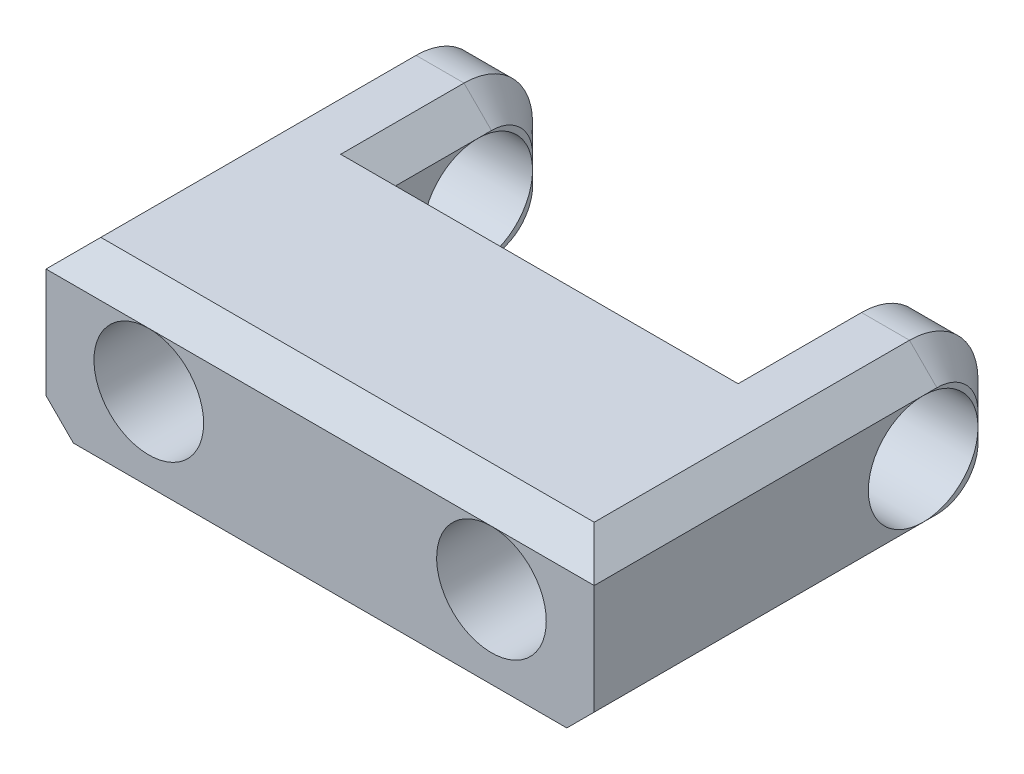
from build123d import *

# Parameters (mm, degrees)
SKETCH1_W           = 40
SKETCH1_H           = 30
BOSS_EXTRUDE1_DEPTH = 12
SKETCH2_W           = 25
SKETCH2_H           = 12
CUT_EXTRUDE1_DEPTH  = 12
SKETCH3_R           = 4
CUT_EXTRUDE2_DEPTH  = 100
FILLET1_R           = 5
SKETCH4_R           = 4
CUT_EXTRUDE3_DEPTH  = 12.5
CHAMFER1_SIZE       = 2


with BuildPart() as part:
    # Sketch1 → Boss-Extrude1 (new body)
    with BuildSketch(Plane(origin=(0, 0, 0), x_dir=(1, 0, 0), z_dir=(0, 1, 0))):
        Rectangle(SKETCH1_W, SKETCH1_H)
    extrude(amount=BOSS_EXTRUDE1_DEPTH)

    # Sketch2 → Cut-Extrude1 (cut)
    with BuildSketch(Plane(origin=(0, 12, 0), x_dir=(1, 0, 0), z_dir=(0, 1, 0))):
        with Locations((0, 9)):
            Rectangle(SKETCH2_W, SKETCH2_H)
    extrude(amount=-CUT_EXTRUDE1_DEPTH, mode=Mode.SUBTRACT)

    # Sketch3 → Cut-Extrude2 (cut)
    with BuildSketch(Plane(origin=(20, 0, 0), x_dir=(0, 0, -1), z_dir=(1, 0, 0))):
        with Locations((9, 6)):
            Circle(SKETCH3_R)
    extrude(amount=-CUT_EXTRUDE2_DEPTH, mode=Mode.SUBTRACT)

    # Fillet1
    fillet1_edges = [part.edges().sort_by_distance(p)[0] for p in [
        (-16.25, 0, -15),
        (-16.25, 12, -15),
        (16.25, 0, -15),
        (16.25, 12, -15),
    ]]
    fillet(fillet1_edges, radius=FILLET1_R)

    # Sketch4 → Cut-Extrude3 (cut)
    with BuildSketch(Plane.XY.offset(15)):
        with Locations((-12.5, 6)):
            Circle(SKETCH4_R)
        with Locations((12.5, 6)):
            Circle(SKETCH4_R)
    extrude(amount=-CUT_EXTRUDE3_DEPTH, mode=Mode.SUBTRACT)

    # Chamfer1
    chamfer1_edges = [part.edges().sort_by_distance(p)[0] for p in [
        (0, 12, 15),
        (12.5, 0, -6.5),
        (12.5, 12, -6.5),
        (0, 12, -3),
        (-12.5, 6, -15),
        (-20, 6, -15),
        (20, 12, 2.5),
        (-20, 0, 2.5),
        (-20, 12, 2.5),
        (-20, 10.535533906, -13.535533906),
        (-20, 1.464466094, -13.535533906),
        (-12.5, 0, -6.5),
        (-12.5, 12, -6.5),
        (-12.5, 10.535533906, -13.535533906),
        (-12.5, 1.464466094, -13.535533906),
        (12.5, 6, -15),
        (20, 6, -15),
        (12.5, 10.535533906, -13.535533906),
        (12.5, 1.464466094, -13.535533906),
        (20, 10.535533906, -13.535533906),
        (20, 1.464466094, -13.535533906),
        (20, 0, 2.5),
    ]]
    chamfer(chamfer1_edges, length=CHAMFER1_SIZE - 0.0001)  # a hair under: the kernel refuses the full size


solid = part.part
